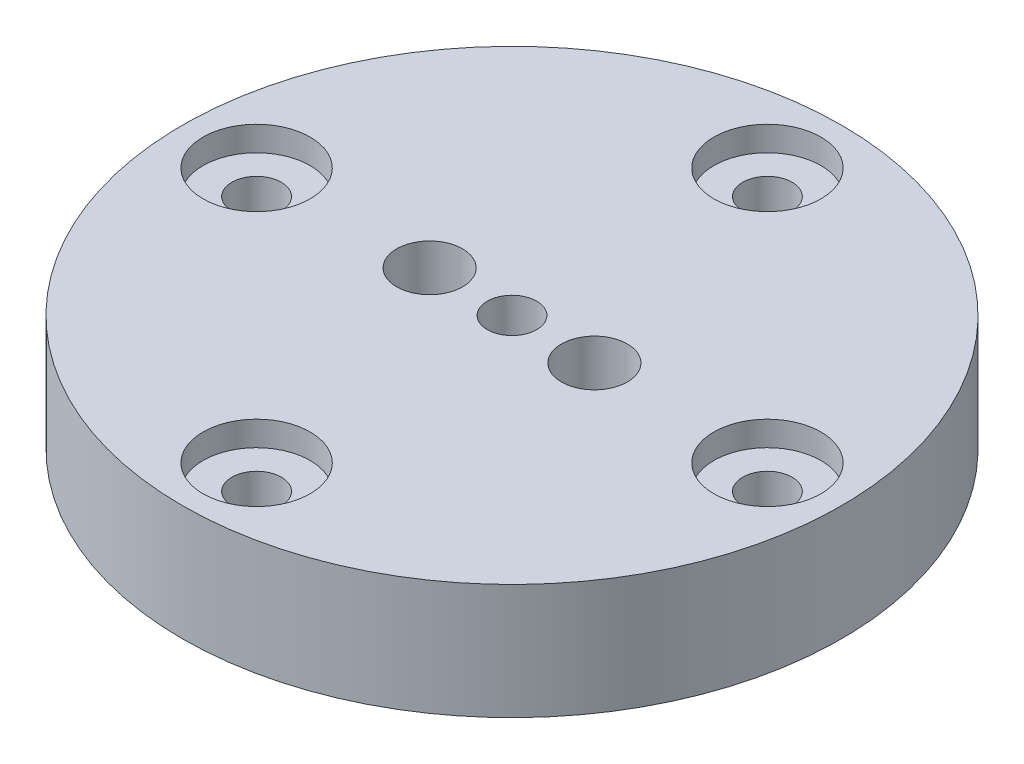
from build123d import *

# Parameters (mm, degrees)
SKETCH1_R           = 20
SKETCH1_R_2         = 1.5
SKETCH1_R_3         = 2
BOSS_EXTRUDE1_DEPTH = 7
SKETCH2_R           = 3.25
CUT_EXTRUDE1_DEPTH  = 1.5


with BuildPart() as part:
    # Sketch1 → Boss-Extrude1 (new body)
    with BuildSketch(Plane(origin=(0, 0, 0), x_dir=(1, 0, 0), z_dir=(0, 1, 0))):
        Circle(SKETCH1_R)
        with Locations((0, 15.5)):
            Circle(SKETCH1_R_2, mode=Mode.SUBTRACT)
        with Locations((15.5, 0)):
            Circle(SKETCH1_R_2, mode=Mode.SUBTRACT)
        with Locations((0, -15.5)):
            Circle(SKETCH1_R_2, mode=Mode.SUBTRACT)
        with Locations((-15.5, 0)):
            Circle(SKETCH1_R_2, mode=Mode.SUBTRACT)
        with Locations((-5, 0)):
            Circle(SKETCH1_R_3, mode=Mode.SUBTRACT)
        with Locations((5, 0)):
            Circle(SKETCH1_R_3, mode=Mode.SUBTRACT)
        Circle(SKETCH1_R_2, mode=Mode.SUBTRACT)
    extrude(amount=BOSS_EXTRUDE1_DEPTH)

    # Sketch2 → Cut-Extrude1 (cut)
    with BuildSketch(Plane(origin=(0, 7, 0), x_dir=(1, 0, 0), z_dir=(0, 1, 0))):
        with Locations((0, 15.5)):
            Circle(SKETCH2_R)
        with Locations((15.5, 0)):
            Circle(SKETCH2_R)
        with Locations((0, -15.5)):
            Circle(SKETCH2_R)
        with Locations((-15.5, 0)):
            Circle(SKETCH2_R)
    extrude(amount=-CUT_EXTRUDE1_DEPTH, mode=Mode.SUBTRACT)


solid = part.part
